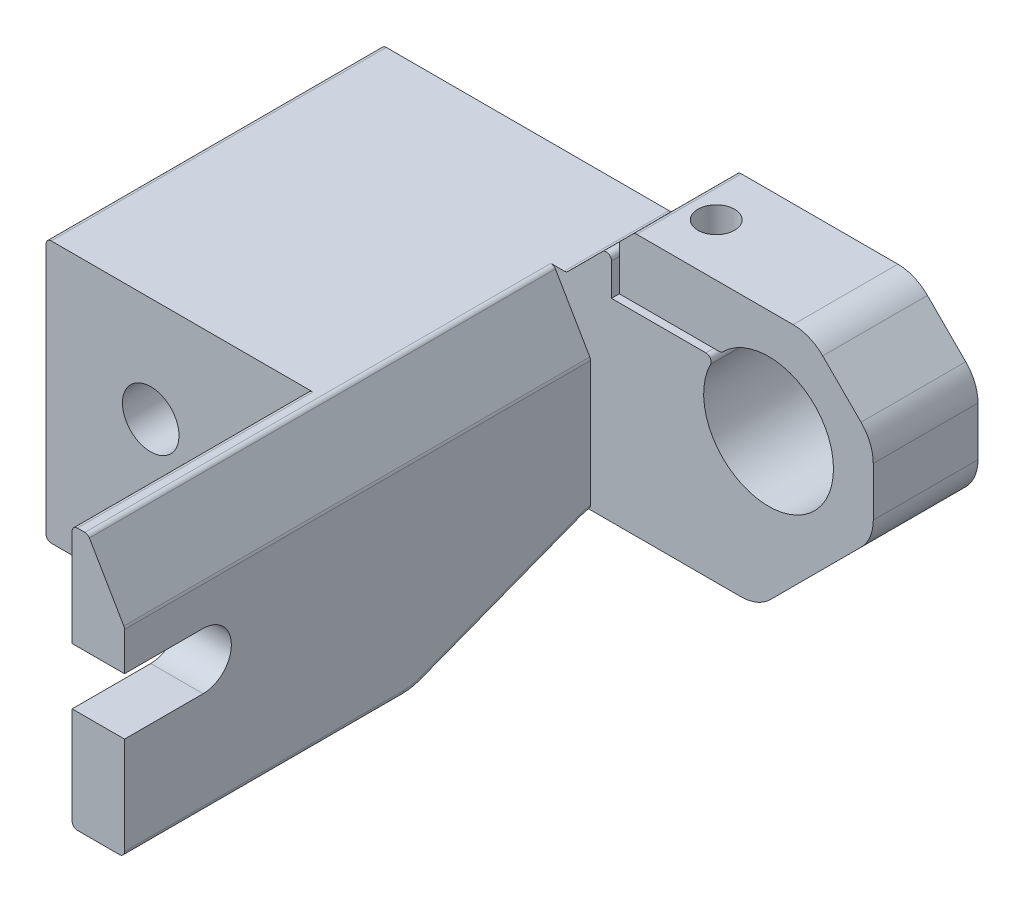
from build123d import *

# Parameters (mm, degrees)
BOSS_EXTRUDE1_DEPTH = 10
BOSS_EXTRUDE2_DEPTH = 30
SKETCH3_W           = 5
SKETCH3_H           = 25
BOSS_EXTRUDE3_DEPTH = 22.5
SKETCH4_R           = 5.25
CUT_EXTRUDE1_DEPTH  = 27
SKETCH5_R           = 2.7
CUT_EXTRUDE3_DEPTH  = 4.6
CUT_EXTRUDE4_DEPTH  = 44.5
CUT_EXTRUDE5_REACH  = 67.133
FILLET1_R           = 4
FILLET2_R           = 0.5
FILLET3_R           = 5
FILLET4_R           = 0.5


with BuildPart() as part:
    # Sketch1 → Boss-Extrude1 (new body)
    with BuildSketch(Plane.XY):
        with BuildLine():
            Line((-22.5, 15.75), (-28.5, 9.75))
            Line((-28.5, 9.75), (-28.5, 9.25))
            Line((-28.5, 9.25), (-28.5, 1.75))
            Line((-28.5, 1.75), (-17.5, -9.25))
            Line((-17.5, -9.25), (28.5, -9.25))
            Line((28.5, -9.25), (28.5, 9.25))
            Line((28.5, 9.25), (0.8, 9.25))
            Line((0.8, 9.25), (-3.5, 13.55))
            Line((-3.5, 13.55), (-3.5, 9.25))
            Line((-3.5, 9.25), (-13.382383367, 9.25))
            ThreePointArc((-13.382383367, 9.25), (-23.330458604, 1.863270054), (-13.985855563, 10))
            Line((-13.985855563, 10), (-4.25, 10))
            Line((-4.25, 10), (-4.25, 14.3))
            Line((-4.25, 14.3), (-5.7, 15.75))
            Line((-5.7, 15.75), (-22.5, 15.75))
        make_face()
    extrude(amount=BOSS_EXTRUDE1_DEPTH)

    # Sketch2 → Boss-Extrude2 (add)
    with BuildSketch(Plane(origin=(28.5, 0, 0), x_dir=(0, 0, -1), z_dir=(1, 0, 0))):
        Polygon((-10, 9.25), (-10, -9.25), (-26.933078921, -15.75), (-32, -15.75), (-32, 9.25), align=None)
    extrude(amount=-BOSS_EXTRUDE2_DEPTH)

    # Sketch3 → Boss-Extrude3 (add)
    with BuildSketch(Plane.XY.offset(32)):
        with Locations((1, -3.25)):
            Rectangle(SKETCH3_W, SKETCH3_H)
    extrude(amount=BOSS_EXTRUDE3_DEPTH)

    # Sketch4 → Cut-Extrude1 (cut)
    with BuildSketch(Plane(origin=(0, 0, 0), x_dir=(-1, 0, 0), z_dir=(0, 0, -1))):
        with Locations((-18.5, -0.75)):
            Circle(SKETCH4_R)
    extrude(amount=-CUT_EXTRUDE1_DEPTH, mode=Mode.SUBTRACT)

    # Sketch5 → Cut-Extrude3 (cut)
    with BuildSketch(Plane.XY.offset(32)):
        with Locations((18.5, -0.75)):
            Circle(SKETCH5_R)
    extrude(amount=-CUT_EXTRUDE3_DEPTH, mode=Mode.SUBTRACT)

    # Sketch6 → Cut-Extrude4 (cut)
    with BuildSketch(Plane.XY.offset(54.5)):
        Polygon((-1.5, 9.25), (2, 9.25), (-1.5, 3.25), align=None)
    extrude(amount=-CUT_EXTRUDE4_DEPTH, mode=Mode.SUBTRACT)

    # Sketch7 → Cut-Extrude5 (cut, up to next)
    with BuildSketch(Plane(origin=(3.5, 0, 0), x_dir=(0, 0, -1), z_dir=(1, 0, 0)), mode=Mode.PRIVATE) as cut_extrude5_sk1:
        with BuildLine():
            Line((-47, -5.95), (-54.5, -5.95))
            Line((-54.5, -5.95), (-54.5, -0.55))
            Line((-54.5, -0.55), (-47, -0.55))
            ThreePointArc((-47, -0.55), (-44.3, -3.25), (-47, -5.95))
        make_face()
    cut_extrude5_tool1 = extrude(cut_extrude5_sk1.sketch, amount=-CUT_EXTRUDE5_REACH, mode=Mode.PRIVATE) & part.part
    add(cut_extrude5_tool1.solids().sort_by_distance((3.5, -3.25, 49.670838))[0], mode=Mode.SUBTRACT)

    # Fillet1
    fillet1_edges = [part.edges().sort_by_distance(p)[0] for p in [
        (-17.5, -9.25, 5),
        (-28.5, 1.75, 5),
        (-28.5, 9.75, 5),
        (-22.5, 15.75, 5),
    ]]
    fillet(fillet1_edges, radius=FILLET1_R)

    # Fillet2
    fillet2_edges = [part.edges().sort_by_distance(p)[0] for p in [
        (3.5, -15.75, 43.25),
        (3.5, 9.25, 43.25),
        (-1.5, 3.25, 32.25),
        (2, 9.25, 32.25),
        (-13.985855563, 10, 5),
        (-13.382383367, 9.25, 5),
        (-3.5, 13.55, 5),
        (-4.25, 14.3, 5),
        (28.5, 9.25, 16),
        (0.8, 9.25, 5),
        (-5.7, 15.75, 5),
    ]]
    fillet(fillet2_edges, radius=FILLET2_R)

    # Fillet3
    fillet3_edges = [part.edges().sort_by_distance(p)[0] for p in [
        (13.5, -9.25, 10),
        (13.5, -15.75, 26.933078921),
    ]]
    fillet(fillet3_edges, radius=FILLET3_R)

    # Fillet4
    # the kernel refuses this fillet: 0.5 mm, written as the material it takes off along each edge
    with BuildSketch(Plane(origin=(28.5, -15.75, 27.859774145), x_dir=(-1, 0, 0), z_dir=(0, 0, 1))) as fillet4_piece_1:
        with BuildLine():
            CenterArc((FILLET4_R, -FILLET4_R), FILLET4_R, 90, 90)
            Line((0, -FILLET4_R), (0, 0))
            Line((0, 0), (FILLET4_R, 0))
        make_face()
    extrude(amount=5.390225855, mode=Mode.SUBTRACT)
    with BuildSketch(Plane(origin=(28.5, -10.75, 27.859774145), x_dir=(0, -1, 0), z_dir=(0, 0, 1))) as fillet4_piece_2:
        with BuildLine():
            CenterArc((5 - FILLET4_R, -FILLET4_R), FILLET4_R, 0, 90)
            Line((5, -FILLET4_R), (5, 0))
            Line((5, 0), (5 - FILLET4_R, 0))
        make_face()
    revolve(axis=Axis((28.5, -10.75, 27.859774145), (1, 0, 0)), revolution_arc=21, mode=Mode.SUBTRACT)
    with BuildSketch(Plane(origin=(28.5, -9.25, -1.25), x_dir=(0, 1, 0), z_dir=(0, 0, 1))) as fillet4_piece_3:
        with BuildLine():
            CenterArc((FILLET4_R, FILLET4_R), FILLET4_R, 180, 90)
            Line((0, FILLET4_R), (0, 0))
            Line((0, 0), (FILLET4_R, 0))
        make_face()
    extrude(amount=10.323304775, mode=Mode.SUBTRACT)
    with BuildSketch(Plane(origin=(28.5, -14.25, 9.073304775), x_dir=(0, 0.9335804264972017, 0.35836794954530055), z_dir=(0, -0.35836794954530055, 0.9335804264972017))) as fillet4_piece_4:
        with BuildLine():
            CenterArc((5 + FILLET4_R, FILLET4_R), FILLET4_R, 180, 90)
            Line((5, FILLET4_R), (5, 0))
            Line((5, 0), (5 + FILLET4_R, 0))
        make_face()
    revolve(axis=Axis((28.5, -14.25, 9.073304775), (-1, 0, 0)), revolution_arc=21, mode=Mode.SUBTRACT)
    with BuildSketch(Plane(origin=(-1.5, -14.25, 9.073304775), x_dir=(0, 0.9335804264972017, 0.35836794954530055), z_dir=(0, -0.35836794954530055, 0.9335804264972017))) as fillet4_piece_5_section:
        with BuildLine():
            CenterArc((5 + FILLET4_R, -FILLET4_R), FILLET4_R, 90, 90)
            Line((5, -FILLET4_R), (5, 0))
            Line((5, 0), (5 + FILLET4_R, 0))
        make_face()
    fillet4_piece_5 = revolve(axis=Axis((-1.5, -14.25, 9.073304775), (-1, 0, 0)), revolution_arc=35.324258071, mode=Mode.PRIVATE)
    fillet4_piece_5 = split(fillet4_piece_5, bisect_by=Plane(origin=(-1.457320012, -9.164080053, 10), z_dir=(0, 0, 1)), keep=Keep.TOP, mode=Mode.PRIVATE)
    add(fillet4_piece_5, mode=Mode.SUBTRACT)
    with BuildSketch(Plane(origin=(-1.5, -14.25, 9.073304775), x_dir=(0, 0.9335804264972017, 0.35836794954530055), z_dir=(0, -0.35836794954530055, 0.9335804264972017))) as fillet4_piece_6_section:
        with BuildLine():
            CenterArc((5 + FILLET4_R, -FILLET4_R), FILLET4_R, 90, 90)
            Line((5, -FILLET4_R), (5, 0))
            Line((5, 0), (5 + FILLET4_R, 0))
        make_face()
    fillet4_piece_6 = revolve(axis=Axis((-1.5, -14.25, 9.073304775), (-1, 0, 0)), revolution_arc=35.324258071, mode=Mode.PRIVATE)
    fillet4_piece_6 = split(fillet4_piece_6, bisect_by=Plane(origin=(-1.316288707, -9.25, 9.750524402), z_dir=(0, -1, 0)), keep=Keep.TOP, mode=Mode.PRIVATE)
    add(fillet4_piece_6, mode=Mode.SUBTRACT)
    with BuildSketch(Plane(origin=(-1.5, -9.582097868, 10.865144523), x_dir=(0, 0.9335804264972015, 0.3583679495453009), z_dir=(0, -0.3583679495453009, 0.9335804264972015))) as fillet4_piece_7:
        with BuildLine():
            CenterArc((FILLET4_R, -FILLET4_R), FILLET4_R, 90, 90)
            Line((0, -FILLET4_R), (0, 0))
            Line((0, 0), (FILLET4_R, 0))
        make_face()
    extrude(amount=16.284392263, mode=Mode.SUBTRACT)
    with BuildSketch(Plane(origin=(28.5, -9.582097868, 10.865144523), x_dir=(0, 0.9335804264972015, 0.3583679495453009), z_dir=(0, -0.3583679495453009, 0.9335804264972015))) as fillet4_piece_8:
        with BuildLine():
            CenterArc((FILLET4_R, FILLET4_R), FILLET4_R, 180, 90)
            Line((0, FILLET4_R), (0, 0))
            Line((0, 0), (FILLET4_R, 0))
        make_face()
    extrude(amount=16.284392263, mode=Mode.SUBTRACT)
    with BuildSketch(Plane(origin=(-1.5, -10.75, 27.859774145), x_dir=(0, -1, 0), z_dir=(0, 0, 1))) as fillet4_piece_9:
        with BuildLine():
            CenterArc((5 - FILLET4_R, FILLET4_R), FILLET4_R, 270, 90)
            Line((5 - FILLET4_R, 0), (5, 0))
            Line((5, 0), (5, FILLET4_R))
        make_face()
    revolve(axis=Axis((-1.5, -10.75, 27.859774145), (1, 0, 0)), revolution_arc=21, mode=Mode.SUBTRACT)
    with BuildSketch(Plane(origin=(-1.5, -15.75, 27.859774145), x_dir=(1, 0, 0), z_dir=(0, 0, 1))) as fillet4_piece_10:
        with BuildLine():
            CenterArc((FILLET4_R, FILLET4_R), FILLET4_R, 180, 90)
            Line((0, FILLET4_R), (0, 0))
            Line((0, 0), (FILLET4_R, 0))
        make_face()
    extrude(amount=27.890225855, mode=Mode.SUBTRACT)

    # Sketch8 → Cut-Revolve1 (revolve, cut)
    with BuildSketch(Plane.XY.offset(5), mode=Mode.PRIVATE) as cut_revolve1_sk:
        Polygon((-8.5, 15.75), (-6.75, 15.75), (-6.75, -4.25), (-6.15, -4.25), (-6.15, -8.75), (-6, -8.75), (-6, -9.25), (-8.5, -9.25), align=None)
    revolve(cut_revolve1_sk.sketch.rotate(Axis((-8.5, 24.852937644, 5), (0, -1, 0)), 180), axis=Axis((-8.5, 24.852937644, 5), (0, -1, 0)), mode=Mode.SUBTRACT)


with BuildPart() as body_2:
    # Mirror1: mirrored copy
    add(part.part.mirror(Plane(origin=(0, 0, 0), x_dir=(0, 0, 1), z_dir=(1, 0, 0))))


solid = body_2.part
